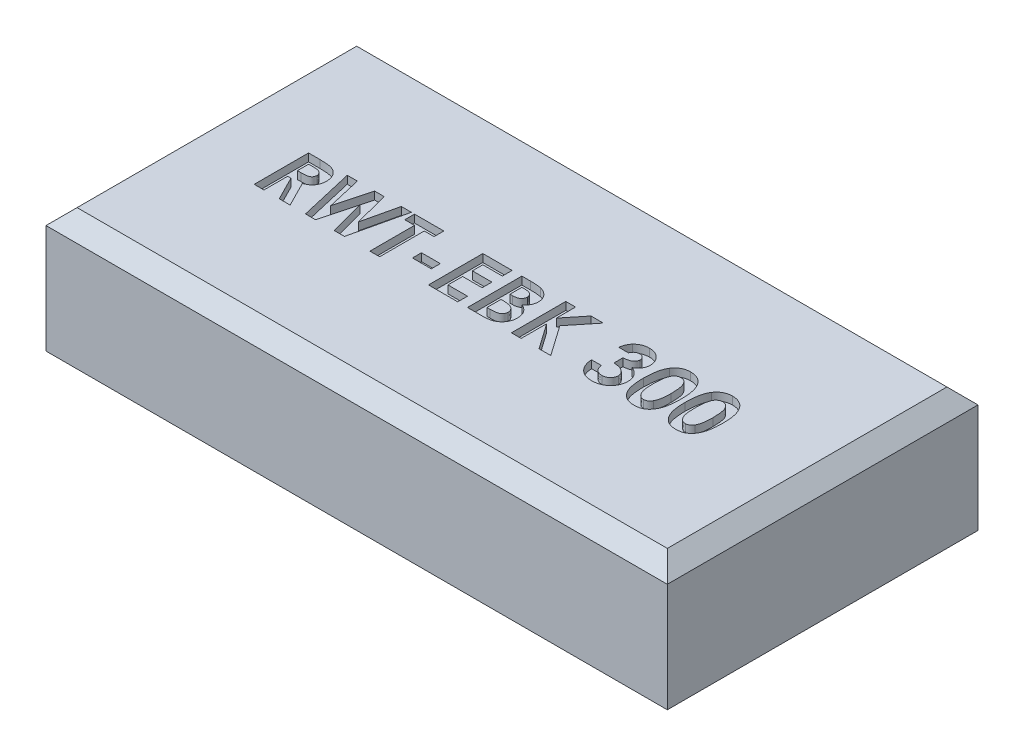
from build123d import *

# Parameters (mm, degrees)
SKETCH1_W           = 40
SKETCH1_H           = 20
BOSS_EXTRUDE1_DEPTH = 8
CHAMFER1_SIZE       = 1
SKETCH4_W           = 1.211538461
SKETCH4_H           = 0.583333333
CUT_EXTRUDE3_DEPTH  = 0.5


with BuildPart() as part:
    # Sketch1 → Boss-Extrude1 (new body)
    with BuildSketch(Plane(origin=(0, 0, 0), x_dir=(1, 0, 0), z_dir=(0, 1, 0))):
        with Locations((0, 2.318501171)):
            Rectangle(SKETCH1_W, SKETCH1_H)
    extrude(amount=BOSS_EXTRUDE1_DEPTH)

    # Chamfer1
    chamfer1_edges = [part.edges().sort_by_distance(p)[0] for p in [
        (0, 8, 7.681498829),
        (-20, 8, -2.318501171),
        (0, 8, -12.318501171),
        (20, 8, -2.318501171),
    ]]
    chamfer(chamfer1_edges, length=CHAMFER1_SIZE)

    # Sketch4 → Cut-Extrude3 (cut)
    # profile 1 of 10: a face of its own
    with BuildSketch(Plane(origin=(0, 8, 0), x_dir=(1, 0, 0), z_dir=(0, 1, 0))):
        with BuildLine():
            Line((-14.596153846, 3.818501171), (-13.864182692, 3.818501171))
            add(Edge.make_bspline(
                [(-13.864182692, 3.818501171), (-13.815799622, 3.818329439), (-13.722745349, 3.81799915), (-13.588566169, 3.81278806), (-13.46530414, 3.805536401), (-13.352776761, 3.794470177), (-13.251032173, 3.779797701), (-13.159968404, 3.76250128), (-13.079588115, 3.742788301), (-13.009213411, 3.718224373), (-12.945703721, 3.690516634), (-12.886503859, 3.658679935), (-12.830307791, 3.623068786), (-12.777491125, 3.582746162), (-12.727594872, 3.538437457), (-12.6805249, 3.49009807), (-12.636946351, 3.437318103), (-12.597129066, 3.380431058), (-12.560838815, 3.320587191), (-12.528765845, 3.257704336), (-12.502684052, 3.191738763), (-12.479637993, 3.123643816), (-12.463038663, 3.052446065), (-12.451494071, 2.978838632), (-12.443041573, 2.902562411), (-12.442555595, 2.850743733), (-12.442307692, 2.824310466)],
                knots=[0, 0, 0, 0, 1.749336639, 3.364467119, 4.854658419, 6.213483162, 7.451590619, 8.570285859, 9.5643256, 10.440900261, 11.26203566, 12.067320669, 12.869050712, 13.665104639, 14.467235401, 15.27997916, 16.102287765, 16.939272006, 17.78853747, 18.631303466, 19.488103222, 20.351255419, 21.228522269, 22.127379805, 23.044756219, 24, 24, 24, 24], degree=3))
            add(Edge.make_bspline(
                [(-12.442307692, 2.824310466), (-12.442951654, 2.796720207), (-12.444214347, 2.742620739), (-12.451015895, 2.663153032), (-12.46344699, 2.587123888), (-12.48227569, 2.514755912), (-12.503916836, 2.4451484), (-12.532694008, 2.379585653), (-12.565171892, 2.317114157), (-12.603744925, 2.258617595), (-12.646076944, 2.20279664), (-12.695308193, 2.151790002), (-12.748249241, 2.102856265), (-12.807876098, 2.059060474), (-12.871560358, 2.017441316), (-12.940567358, 1.979723274), (-13.014446736, 1.944958206), (-13.066387598, 1.925570802), (-13.092948718, 1.91565662)],
                knots=[0, 0, 0, 0, 1.099860209, 2.156625411, 3.176576793, 4.16617041, 5.135385252, 6.078461593, 7.016046972, 7.938469504, 8.868247731, 9.803980173, 10.76021508, 11.73834243, 12.748633912, 13.790971185, 14.870363756, 16, 16, 16, 16], degree=3))
            Line((-13.092948718, 1.91565662), (-12.28525641, 0.318501171))
            Line((-12.28525641, 0.318501171), (-12.983573718, 0.318501171))
            Line((-12.983573718, 0.318501171), (-13.754807692, 1.844142197))
            Line((-13.754807692, 1.844142197), (-13.967948718, 1.844142197))
            Line((-13.967948718, 1.844142197), (-13.967948718, 0.318501171))
            Line((-13.967948718, 0.318501171), (-14.596153846, 0.318501171))
            Line((-14.596153846, 0.318501171), (-14.596153846, 3.818501171))
        make_face()
        with BuildLine():
            Line((-13.967948718, 2.472347325), (-13.723257212, 2.472347325))
            add(Edge.make_bspline(
                [(-13.723257212, 2.472347325), (-13.693341641, 2.472684254), (-13.636059751, 2.473329401), (-13.55368087, 2.476321861), (-13.4788612, 2.483532211), (-13.41127944, 2.492642218), (-13.350595524, 2.503161037), (-13.297350732, 2.518235143), (-13.250724642, 2.534387429), (-13.211269776, 2.554460531), (-13.177560445, 2.577288002), (-13.148454596, 2.603220576), (-13.124379885, 2.633234229), (-13.104565169, 2.666513318), (-13.089151475, 2.70335219), (-13.07790066, 2.743346436), (-13.071613117, 2.786951643), (-13.070889714, 2.817045173), (-13.070512821, 2.832723927)],
                knots=[0, 0, 0, 0, 1.688639943, 3.233382647, 4.650958383, 5.928841754, 7.082724185, 8.122798841, 9.049171256, 9.863274652, 10.613301712, 11.341792392, 12.054588806, 12.776240173, 13.521029143, 14.301969904, 15.115324896, 16, 16, 16, 16], degree=3))
            add(Edge.make_bspline(
                [(-13.070512821, 2.832723927), (-13.071225372, 2.851273039), (-13.072625049, 2.88770933), (-13.086514186, 2.940164814), (-13.108622693, 2.988715953), (-13.1389274, 3.033143381), (-13.177092239, 3.072091531), (-13.220889403, 3.106424636), (-13.27126414, 3.133572687), (-13.317907356, 3.151479252), (-13.36034178, 3.162192934), (-13.398637509, 3.170176676), (-13.442984193, 3.175834983), (-13.493415313, 3.181836624), (-13.549802317, 3.185728385), (-13.612452548, 3.188568594), (-13.681186076, 3.189730664), (-13.729099873, 3.190102157), (-13.754106571, 3.190296043)],
                knots=[0, 0, 0, 0, 1.020303359, 2.004196876, 2.966617323, 3.9489082, 4.950758222, 5.960522915, 7.003732012, 8.091992268, 8.70421221, 9.413913587, 10.24622431, 11.166358409, 12.212345909, 13.359657661, 14.621978493, 16, 16, 16, 16], degree=3))
            Line((-13.754106571, 3.190296043), (-13.967948718, 3.190296043))
            Line((-13.967948718, 3.190296043), (-13.967948718, 2.472347325))
        make_face(mode=Mode.SUBTRACT)
    # profile 2 of 10: a face of its own
    with BuildSketch(Plane(origin=(0, 8, 0), x_dir=(1, 0, 0), z_dir=(0, 1, 0))):
        Polygon((-12.105769231, 3.818501171), (-11.457231571, 3.818501171), (-10.939102564, 1.584026011), (-10.345252404, 3.818501171), (-9.734575321, 3.818501171), (-9.144230769, 1.584026011), (-8.627504006, 3.818501171), (-7.977564103, 3.818501171), (-8.787359776, 0.318501171), (-9.443609776, 0.318501171), (-10.041666667, 2.581021203), (-10.643229167, 0.318501171), (-11.294571314, 0.318501171), align=None)
    # profile 3 of 10: a face of its own
    with BuildSketch(Plane(origin=(0, 8, 0), x_dir=(1, 0, 0), z_dir=(0, 1, 0))):
        Polygon((-7.775641026, 3.818501171), (-5.891025641, 3.818501171), (-5.891025641, 3.190296043), (-6.519230769, 3.190296043), (-6.519230769, 0.318501171), (-7.147435897, 0.318501171), (-7.147435897, 3.190296043), (-7.775641026, 3.190296043), align=None)
    # profile 4 of 10: a face of its own
    with BuildSketch(Plane(origin=(0, 8, 0), x_dir=(1, 0, 0), z_dir=(0, 1, 0))):
        with Locations((-4.791666667, 1.597347325)):
            Rectangle(SKETCH4_W, SKETCH4_H)
    # profile 5 of 10: a face of its own
    with BuildSketch(Plane(origin=(0, 8, 0), x_dir=(1, 0, 0), z_dir=(0, 1, 0))):
        Polygon((-3.378205128, 3.818501171), (-1.493589744, 3.818501171), (-1.493589744, 3.190296043), (-2.75, 3.190296043), (-2.75, 2.51721912), (-1.493589744, 2.51721912), (-1.493589744, 1.889013991), (-2.75, 1.889013991), (-2.75, 0.946706299), (-1.493589744, 0.946706299), (-1.493589744, 0.318501171), (-3.378205128, 0.318501171), align=None)
    # profile 6 of 10: a face of its own
    with BuildSketch(Plane(origin=(0, 8, 0), x_dir=(1, 0, 0), z_dir=(0, 1, 0))):
        with BuildLine():
            Line((-0.865384615, 0.318501171), (-0.865384615, 3.818501171))
            Line((-0.865384615, 3.818501171), (-0.304487179, 3.818501171))
            add(Edge.make_bspline(
                [(-0.304487179, 3.818501171), (-0.265220852, 3.818505652), (-0.189241252, 3.818514323), (-0.079622519, 3.814664873), (0.022039599, 3.809685178), (0.115421572, 3.804114058), (0.200682344, 3.794513904), (0.277692262, 3.784396391), (0.346605192, 3.772195293), (0.389210312, 3.76125053), (0.409254808, 3.756101331)],
                knots=[0, 0, 0, 0, 1.311965854, 2.538629056, 3.664479157, 4.713267157, 5.663616078, 6.530575999, 7.308677837, 8, 8, 8, 8], degree=3))
            add(Edge.make_bspline(
                [(0.409254808, 3.756101331), (0.435575266, 3.748838294), (0.487224455, 3.734585883), (0.561202576, 3.705802524), (0.631381143, 3.673807779), (0.697674471, 3.637307759), (0.759675491, 3.595861807), (0.817148578, 3.549140995), (0.871333285, 3.499020694), (0.920305637, 3.444104065), (0.964568575, 3.386074475), (1.003025131, 3.324947127), (1.03643895, 3.2616567), (1.063178757, 3.195406725), (1.083326699, 3.126502301), (1.09806282, 3.055237661), (1.107613822, 2.981387306), (1.108516267, 2.931144495), (1.108974359, 2.905640594)],
                knots=[0, 0, 0, 0, 1.099996261, 2.158545794, 3.195537121, 4.207578794, 5.205712374, 6.197378256, 7.190519799, 8.17788031, 9.159561366, 10.129234751, 11.085776129, 12.040971148, 13.00380137, 13.975669004, 14.972423361, 16, 16, 16, 16], degree=3))
            add(Edge.make_bspline(
                [(1.108974359, 2.905640594), (1.107776583, 2.872874775), (1.105418909, 2.808379286), (1.090357925, 2.713647082), (1.062116233, 2.624111532), (1.025162666, 2.538122532), (0.974917368, 2.456000819), (0.911115557, 2.377785442), (0.834790614, 2.30106803), (0.776245169, 2.255081117), (0.745793269, 2.231161427)],
                knots=[0, 0, 0, 0, 0.986156485, 1.941127874, 2.875419072, 3.804401753, 4.751181392, 5.761612777, 6.835722519, 8, 8, 8, 8], degree=3))
            add(Edge.make_bspline(
                [(0.745793269, 2.231161427), (0.770470028, 2.218564156), (0.818854324, 2.193864392), (0.887545811, 2.153265354), (0.951146629, 2.110083128), (1.009941945, 2.065186558), (1.062698461, 2.016672412), (1.111594582, 1.967336144), (1.154218027, 1.914350989), (1.192333195, 1.85960544), (1.225462281, 1.802306775), (1.254314061, 1.742551757), (1.278684124, 1.680136252), (1.299321324, 1.615377904), (1.314712554, 1.548053973), (1.324747963, 1.478140383), (1.332431699, 1.405875574), (1.333029422, 1.35665059), (1.333333333, 1.331622165)],
                knots=[0, 0, 0, 0, 1.164658916, 2.283573913, 3.35186032, 4.395461096, 5.390182219, 6.362969632, 7.312859996, 8.245001507, 9.165155236, 10.092416118, 11.032087915, 11.979892451, 12.947605196, 13.931445124, 14.948243989, 16, 16, 16, 16], degree=3))
            add(Edge.make_bspline(
                [(1.333333333, 1.331622165), (1.331361149, 1.283819302), (1.327469051, 1.189480545), (1.29901193, 1.050969584), (1.249676325, 0.91964863), (1.18342878, 0.796039608), (1.101799059, 0.683720797), (1.007948289, 0.585330494), (0.902821331, 0.502045287), (0.805829006, 0.445834233), (0.721938284, 0.40811136), (0.652453165, 0.384788701), (0.577827621, 0.363182624), (0.49669469, 0.348010391), (0.410525202, 0.334123096), (0.318478999, 0.325548791), (0.220728113, 0.319738197), (0.153588579, 0.318921849), (0.118990385, 0.318501171)],
                knots=[0, 0, 0, 0, 1.284142165, 2.534249414, 3.780121997, 5.041676246, 6.291546858, 7.49970053, 8.684500223, 9.883330709, 10.50184324, 11.153274765, 11.851151195, 12.587658647, 13.369265475, 14.195992086, 15.070362669, 16, 16, 16, 16], degree=3))
            Line((0.118990385, 0.318501171), (-0.865384615, 0.318501171))
        make_face()
        with BuildLine():
            Line((-0.237179487, 3.190296043), (-0.237179487, 2.42747553))
            Line((-0.237179487, 2.42747553), (-0.0703125, 2.42747553))
            add(Edge.make_bspline(
                [(-0.0703125, 2.42747553), (-0.047633777, 2.427673297), (-0.003853875, 2.428055074), (0.059381549, 2.432972233), (0.118180282, 2.441361212), (0.172319311, 2.453065948), (0.222302963, 2.467929257), (0.267811927, 2.485813017), (0.308646108, 2.507633149), (0.356085982, 2.540135198), (0.406233349, 2.587963419), (0.450377513, 2.657061193), (0.476378131, 2.736523371), (0.479273899, 2.792566252), (0.480769231, 2.821505979)],
                knots=[0, 0, 0, 0, 1.065314748, 2.056525647, 2.977365736, 3.853934255, 4.656397591, 5.425096493, 6.14721249, 6.826394842, 8.123232004, 9.372140726, 10.643011755, 12, 12, 12, 12], degree=3))
            add(Edge.make_bspline(
                [(0.480769231, 2.821505979), (0.479572691, 2.848612841), (0.47725923, 2.901022871), (0.451079951, 2.97461122), (0.410418355, 3.039825558), (0.362411626, 3.084459439), (0.317203962, 3.114943064), (0.278494386, 3.135015233), (0.236007719, 3.152983634), (0.188921466, 3.166722711), (0.137504514, 3.17703203), (0.082006625, 3.184602991), (0.022332045, 3.189756109), (-0.018885315, 3.190112204), (-0.040164263, 3.190296043)],
                knots=[0, 0, 0, 0, 1.347982417, 2.606269829, 3.849316587, 5.153353503, 5.842674298, 6.568177932, 7.326619318, 8.142485038, 9.012069166, 9.942760135, 10.937925643, 12, 12, 12, 12], degree=3))
            Line((-0.040164263, 3.190296043), (-0.237179487, 3.190296043))
        make_face(mode=Mode.SUBTRACT)
        with BuildLine():
            Line((-0.237179487, 1.844142197), (-0.237179487, 0.946706299))
            Line((-0.237179487, 0.946706299), (-0.056290064, 0.946706299))
            add(Edge.make_bspline(
                [(-0.056290064, 0.946706299), (-0.020527995, 0.946910607), (0.048229046, 0.947303413), (0.146723385, 0.952049449), (0.236279363, 0.960603342), (0.316659689, 0.971282188), (0.387987483, 0.985750355), (0.450021639, 1.004144774), (0.503612874, 1.02438184), (0.548439854, 1.049377018), (0.585060929, 1.078465208), (0.618107609, 1.108194036), (0.645051813, 1.142489048), (0.666370569, 1.179878054), (0.684821916, 1.219432285), (0.695950465, 1.262696318), (0.704423352, 1.308387911), (0.704889637, 1.339991798), (0.705128205, 1.356161427)],
                knots=[0, 0, 0, 0, 1.753078804, 3.370512758, 4.83203934, 6.162291463, 7.344201807, 8.395507345, 9.331626367, 10.147333109, 10.898971645, 11.62040215, 12.321813352, 13.025280112, 13.727906689, 14.453419512, 15.208716525, 16, 16, 16, 16], degree=3))
            add(Edge.make_bspline(
                [(0.705128205, 1.356161427), (0.704602095, 1.374651653), (0.703577374, 1.410665639), (0.695208464, 1.463303922), (0.67999942, 1.512445252), (0.660842888, 1.559346239), (0.634185556, 1.602327663), (0.602504228, 1.642876951), (0.564225095, 1.679620976), (0.521177978, 1.714782156), (0.470967777, 1.745567673), (0.413570936, 1.772279563), (0.348675643, 1.79458835), (0.27608088, 1.81235062), (0.196104895, 1.827425213), (0.108163951, 1.83642641), (0.012990452, 1.843120995), (-0.053004401, 1.843794061), (-0.087139423, 1.844142197)],
                knots=[0, 0, 0, 0, 0.845221588, 1.646264278, 2.427170338, 3.19324141, 3.95557735, 4.731569926, 5.540061037, 6.376114724, 7.268642756, 8.224665384, 9.265483498, 10.400594375, 11.639216012, 12.983232105, 14.439614077, 16, 16, 16, 16], degree=3))
            Line((-0.087139423, 1.844142197), (-0.237179487, 1.844142197))
        make_face(mode=Mode.SUBTRACT)
    # profile 7 of 10: a face of its own
    with BuildSketch(Plane(origin=(0, 8, 0), x_dir=(1, 0, 0), z_dir=(0, 1, 0))):
        Polygon((1.961538462, 3.818501171), (2.58974359, 3.818501171), (2.58974359, 2.586630177), (3.582532051, 3.818501171), (4.375500801, 3.818501171), (3.128205128, 2.270424248), (4.496794872, 0.318501171), (3.740284455, 0.318501171), (2.58974359, 1.959827293), (2.58974359, 0.318501171), (1.961538462, 0.318501171), align=None)
    # profile 8 of 10: a face of its own
    with BuildSketch(Plane(origin=(0, 8, 0), x_dir=(1, 0, 0), z_dir=(0, 1, 0))):
        with BuildLine():
            Line((6.852564103, 2.965937068), (6.224358974, 2.965937068))
            add(Edge.make_bspline(
                [(6.224358974, 2.965937068), (6.228794341, 2.997338802), (6.237489585, 3.05889982), (6.25829614, 3.148024838), (6.283183024, 3.232566017), (6.314253028, 3.312255633), (6.350693088, 3.387235639), (6.392132649, 3.45776333), (6.439019689, 3.523535987), (6.474959102, 3.563157697), (6.492888622, 3.582924248)],
                knots=[0, 0, 0, 0, 1.111473889, 2.178970933, 3.205615836, 4.199322666, 5.174200091, 6.12565194, 7.064921805, 8, 8, 8, 8], degree=3))
            add(Edge.make_bspline(
                [(6.492888622, 3.582924248), (6.518749579, 3.60900478), (6.569718807, 3.660406768), (6.654894365, 3.726247036), (6.74417408, 3.783227311), (6.839348495, 3.828401685), (6.938936626, 3.864965107), (7.04373043, 3.88952484), (7.153301684, 3.90582044), (7.22807028, 3.907425614), (7.266225962, 3.908244761)],
                knots=[0, 0, 0, 0, 1.01925491, 2.00884431, 2.983262333, 3.955970413, 4.92937149, 5.924503185, 6.940838805, 8, 8, 8, 8], degree=3))
            add(Edge.make_bspline(
                [(7.266225962, 3.908244761), (7.300148326, 3.90744392), (7.366832858, 3.905869629), (7.464842342, 3.893232074), (7.558286183, 3.87106721), (7.648152109, 3.842087147), (7.733118486, 3.802654929), (7.815060603, 3.756882516), (7.891688996, 3.70074075), (7.963182961, 3.637306204), (8.028863803, 3.568695533), (8.085743699, 3.495356368), (8.134644367, 3.419247767), (8.17493205, 3.339737412), (8.205907803, 3.256690761), (8.227405894, 3.170587565), (8.241476916, 3.081617815), (8.242878758, 3.021146275), (8.243589744, 2.990476331)],
                knots=[0, 0, 0, 0, 1.091422571, 2.145516843, 3.172569842, 4.178562979, 5.178154469, 6.181868002, 7.194278174, 8.227918432, 9.254613415, 10.245994977, 11.209837596, 12.161663635, 13.10878368, 14.055455738, 15.013766427, 16, 16, 16, 16], degree=3))
            add(Edge.make_bspline(
                [(8.243589744, 2.990476331), (8.242130758, 2.95249416), (8.239258465, 2.877718942), (8.21568922, 2.768279854), (8.178796942, 2.663636557), (8.125502458, 2.565253166), (8.058870779, 2.473397426), (7.97711594, 2.39114035), (7.882566532, 2.31719226), (7.811587032, 2.277452547), (7.775240385, 2.257102934)],
                knots=[0, 0, 0, 0, 0.992805628, 1.954529043, 2.915727527, 3.886831945, 4.871318353, 5.87440735, 6.911542536, 8, 8, 8, 8], degree=3))
            add(Edge.make_bspline(
                [(7.775240385, 2.257102934), (7.800188166, 2.248912052), (7.849209437, 2.232817336), (7.91888728, 2.201118976), (7.985142946, 2.166477923), (8.046835538, 2.126234151), (8.104578662, 2.082014939), (8.158020309, 2.033442287), (8.207479781, 1.980622105), (8.252149673, 1.923263901), (8.291795947, 1.86228501), (8.327368437, 1.799094007), (8.35664658, 1.732732589), (8.381448812, 1.663958648), (8.400331819, 1.592154081), (8.413627144, 1.517597124), (8.421312167, 1.440457846), (8.422484265, 1.388196032), (8.423076923, 1.361770402)],
                knots=[0, 0, 0, 0, 1.059543567, 2.081955587, 3.086750234, 4.076226789, 5.052108497, 6.020845489, 6.989030705, 7.970690546, 8.952259656, 9.923888338, 10.895517021, 11.877585046, 12.873342345, 13.889638361, 14.932918083, 16, 16, 16, 16], degree=3))
            add(Edge.make_bspline(
                [(8.423076923, 1.361770402), (8.421875525, 1.322935454), (8.419506612, 1.246360847), (8.404446172, 1.133574287), (8.376406347, 1.026042323), (8.339518404, 0.922527637), (8.290313891, 0.824366565), (8.232408452, 0.729306447), (8.161231032, 0.640643939), (8.082129552, 0.556035035), (7.994282747, 0.479112409), (7.899042519, 0.412423953), (7.798503119, 0.355193392), (7.692028462, 0.308731993), (7.579655542, 0.272951401), (7.461634826, 0.24708754), (7.337470424, 0.231263602), (7.252718505, 0.229604763), (7.209435096, 0.228757581)],
                knots=[0, 0, 0, 0, 1.005138573, 1.981928558, 2.936866704, 3.876260664, 4.820238198, 5.773547, 6.751179199, 7.756627054, 8.768222608, 9.766606018, 10.760583154, 11.757261445, 12.767156078, 13.807575856, 14.880313354, 16, 16, 16, 16], degree=3))
            add(Edge.make_bspline(
                [(7.209435096, 0.228757581), (7.168489689, 0.229650791), (7.088426364, 0.231397344), (6.971316994, 0.246514645), (6.860015623, 0.270900079), (6.754238208, 0.305273369), (6.654393993, 0.349849653), (6.559577553, 0.402930005), (6.471680928, 0.467575977), (6.389724778, 0.540869328), (6.315527135, 0.623100305), (6.249211916, 0.71236407), (6.192241383, 0.809000055), (6.144381897, 0.912595393), (6.106007614, 1.023331819), (6.075738092, 1.140984147), (6.054594335, 1.265782231), (6.048154959, 1.351645968), (6.044871795, 1.395424248)],
                knots=[0, 0, 0, 0, 1.066544725, 2.085487077, 3.070979577, 4.031932826, 4.977951092, 5.916076795, 6.857635327, 7.814973522, 8.776389752, 9.738577119, 10.707772778, 11.69409279, 12.707140348, 13.757286496, 14.856535458, 16, 16, 16, 16], degree=3))
            Line((6.044871795, 1.395424248), (6.673076923, 1.395424248))
            add(Edge.make_bspline(
                [(6.673076923, 1.395424248), (6.677057793, 1.373411954), (6.684811583, 1.33053724), (6.699934873, 1.268464184), (6.719642629, 1.21116692), (6.742429699, 1.158136191), (6.767043166, 1.108675722), (6.796782119, 1.064612209), (6.829467445, 1.024749149), (6.876632609, 0.977359505), (6.944058459, 0.928668623), (7.035105694, 0.88635393), (7.136387121, 0.861552321), (7.20719294, 0.858526601), (7.243790064, 0.856962709)],
                knots=[0, 0, 0, 0, 0.928156231, 1.807827665, 2.648129825, 3.438902246, 4.202261636, 4.936546065, 5.639352463, 6.338805438, 7.70633318, 9.064371875, 10.482673459, 12, 12, 12, 12], degree=3))
            add(Edge.make_bspline(
                [(7.243790064, 0.856962709), (7.263209792, 0.857295725), (7.301248694, 0.857948029), (7.357122177, 0.865177946), (7.410349537, 0.877085623), (7.461029913, 0.893267716), (7.509485937, 0.913552981), (7.554791811, 0.939709615), (7.597870981, 0.970120438), (7.638255136, 1.004310275), (7.675570928, 1.041564958), (7.706619862, 1.082818191), (7.73499634, 1.124738849), (7.755983788, 1.170069529), (7.774373314, 1.216370956), (7.785628643, 1.265323727), (7.794127225, 1.315900945), (7.794621129, 1.350513772), (7.794871795, 1.368080498)],
                knots=[0, 0, 0, 0, 1.110435564, 2.175094844, 3.216326037, 4.226890168, 5.215276772, 6.21526065, 7.213097102, 8.228249917, 9.239874822, 10.221364777, 11.178138315, 12.128914389, 13.072518965, 14.022636769, 14.996447288, 16, 16, 16, 16], degree=3))
            add(Edge.make_bspline(
                [(7.794871795, 1.368080498), (7.794206323, 1.387292705), (7.792881521, 1.425539807), (7.782057749, 1.481353411), (7.764964726, 1.535041599), (7.74122043, 1.586366615), (7.709512568, 1.635139286), (7.672097644, 1.682338139), (7.626027982, 1.725506557), (7.575483393, 1.76817723), (7.516871526, 1.805373188), (7.453046861, 1.839699592), (7.382331987, 1.867012812), (7.306453118, 1.891408576), (7.223974933, 1.909226863), (7.135409592, 1.922164677), (7.040899963, 1.931794874), (6.975753248, 1.933176484), (6.942307692, 1.933885786)],
                knots=[0, 0, 0, 0, 0.809814727, 1.612155564, 2.388397, 3.182215007, 3.988903953, 4.837162975, 5.715530372, 6.646997145, 7.623086902, 8.637258368, 9.698941581, 10.815059213, 11.996518529, 13.252603015, 14.589518788, 16, 16, 16, 16], degree=3))
            Line((6.942307692, 1.933885786), (6.942307692, 2.51721912))
            add(Edge.make_bspline(
                [(6.942307692, 2.51721912), (6.983949398, 2.520765461), (7.061852782, 2.527399962), (7.169986857, 2.542914974), (7.261021809, 2.563653343), (7.337145665, 2.588673062), (7.400354037, 2.6208049), (7.455572522, 2.656277029), (7.503129293, 2.697472724), (7.543321144, 2.743163534), (7.575473375, 2.792231179), (7.59822885, 2.843913002), (7.613255377, 2.896609906), (7.61467914, 2.932652999), (7.615384615, 2.950512389)],
                knots=[0, 0, 0, 0, 1.70044513, 3.18119609, 4.440695891, 5.496282586, 6.431922213, 7.318171381, 8.16090191, 8.983045123, 9.787564368, 10.536848927, 11.275007137, 12, 12, 12, 12], degree=3))
            add(Edge.make_bspline(
                [(7.615384615, 2.950512389), (7.614167468, 2.973299031), (7.611791854, 3.017773733), (7.593341546, 3.0814264), (7.561313904, 3.138167477), (7.518370458, 3.187877565), (7.466042377, 3.229399156), (7.404704693, 3.259543123), (7.335688437, 3.277254049), (7.287131782, 3.279090076), (7.262019231, 3.280039632)],
                knots=[0, 0, 0, 0, 1.009664648, 1.970651636, 2.907870547, 3.878035693, 4.867062054, 5.849714035, 6.887914197, 8, 8, 8, 8], degree=3))
            add(Edge.make_bspline(
                [(7.262019231, 3.280039632), (7.239257527, 3.278919255), (7.194091334, 3.276696084), (7.128044841, 3.26010292), (7.065322678, 3.232170393), (7.007223642, 3.193653085), (6.954586406, 3.147395431), (6.911386421, 3.092612841), (6.875454723, 3.032587436), (6.860224222, 2.988240953), (6.852564103, 2.965937068)],
                knots=[0, 0, 0, 0, 0.98818071, 1.960853194, 2.938124878, 3.957524365, 4.978590984, 5.968022688, 6.978025184, 8, 8, 8, 8], degree=3))
        make_face()
    # profile 9 of 10: a face of its own
    with BuildSketch(Plane(origin=(0, 8, 0), x_dir=(1, 0, 0), z_dir=(0, 1, 0))):
        with BuildLine():
            add(Edge.make_bspline(
                [(9.915765224, 3.908244761), (9.94617296, 3.907793349), (10.005962692, 3.906905754), (10.094021714, 3.897292372), (10.178846898, 3.882769234), (10.260770092, 3.86251452), (10.339201605, 3.835708128), (10.414712276, 3.803621336), (10.48640331, 3.764571127), (10.555188998, 3.720461909), (10.621042843, 3.670524021), (10.682382094, 3.613592251), (10.740326935, 3.550976601), (10.793623075, 3.481730434), (10.843450772, 3.406483618), (10.889646302, 3.325224221), (10.931856026, 3.237554532), (10.970553014, 3.143316345), (11.005155982, 3.04109707), (11.03430202, 2.929724208), (11.059299625, 2.809172324), (11.080399367, 2.679141347), (11.096347361, 2.539458435), (11.107096631, 2.390216385), (11.114473288, 2.231702915), (11.115075319, 2.122963977), (11.115384615, 2.067098927)],
                knots=[0, 0, 0, 0, 0.879237366, 1.728815576, 2.559023295, 3.367336655, 4.166867292, 4.954216142, 5.737608147, 6.525189134, 7.316157332, 8.124696809, 8.942788509, 9.781158001, 10.649253743, 11.551476218, 12.482711956, 13.461909668, 14.496590415, 15.601789533, 16.789733467, 18.056700938, 19.410929216, 20.8549011, 22.384193279, 24, 24, 24, 24], degree=3))
            add(Edge.make_bspline(
                [(11.115384615, 2.067098927), (11.11505035, 2.010534943), (11.114400879, 1.900632136), (11.10740328, 1.740668821), (11.095353086, 1.590343185), (11.079821925, 1.449670779), (11.058548484, 1.31872589), (11.033634327, 1.19716946), (11.004028228, 1.085045549), (10.968285448, 0.982606796), (10.929822694, 0.888203106), (10.887497509, 0.800704352), (10.842047614, 0.71987354), (10.794515494, 0.644491226), (10.742295263, 0.576779642), (10.687928626, 0.514436242), (10.629048363, 0.459835764), (10.568133562, 0.410164346), (10.502952665, 0.367238273), (10.434177868, 0.329695837), (10.360583034, 0.299244462), (10.283509672, 0.272759483), (10.201644051, 0.253746125), (10.116287005, 0.238659651), (10.026474869, 0.23032194), (9.96532715, 0.229287592), (9.933994391, 0.228757581)],
                knots=[0, 0, 0, 0, 1.643780988, 3.193836972, 4.651895693, 6.025988579, 7.305620092, 8.505800249, 9.631074763, 10.672816429, 11.65661981, 12.592235626, 13.49536222, 14.350718032, 15.179365177, 15.97804903, 16.751647189, 17.51006938, 18.259804725, 19.016521909, 19.783502495, 20.571750527, 21.382245291, 22.22305063, 23.089471752, 24, 24, 24, 24], degree=3))
            add(Edge.make_bspline(
                [(9.933994391, 0.228757581), (9.902662478, 0.229297816), (9.841283721, 0.230356128), (9.751228725, 0.238597657), (9.665419329, 0.253807241), (9.58290602, 0.272905453), (9.504263076, 0.299185861), (9.429113408, 0.330548319), (9.358034851, 0.367856509), (9.2908306, 0.410882596), (9.227730109, 0.460221675), (9.167752798, 0.515346009), (9.111031339, 0.576115872), (9.058428606, 0.643211936), (9.00908312, 0.71573861), (8.963509474, 0.794524112), (8.921735059, 0.879453732), (8.882453162, 0.970645855), (8.848322166, 1.070063741), (8.817947164, 1.17859518), (8.793064761, 1.297144871), (8.773052668, 1.425674728), (8.757075024, 1.563912456), (8.745189494, 1.711924777), (8.738153027, 1.869780633), (8.737510367, 1.978282826), (8.737179487, 2.034146203)],
                knots=[0, 0, 0, 0, 0.917216111, 1.796812873, 2.643793957, 3.46689424, 4.273913431, 5.068098542, 5.848489301, 6.620921603, 7.401012384, 8.190319798, 9.003608147, 9.831726257, 10.68377682, 11.569763213, 12.493818149, 13.453288342, 14.474581811, 15.568529029, 16.750744269, 18.018426408, 19.375425659, 20.823733699, 22.36466933, 24, 24, 24, 24], degree=3))
            add(Edge.make_bspline(
                [(8.737179487, 2.034146203), (8.737778845, 2.111763968), (8.738935314, 2.261528446), (8.753590934, 2.477894573), (8.775101668, 2.677887577), (8.80669584, 2.861172919), (8.845761597, 3.028429436), (8.895787333, 3.178555327), (8.952737994, 3.313627923), (9.001267274, 3.393645742), (9.024639423, 3.432183062)],
                knots=[0, 0, 0, 0, 1.288568992, 2.486310467, 3.599230591, 4.627010532, 5.572937695, 6.447898582, 7.252493626, 8, 8, 8, 8], degree=3))
            add(Edge.make_bspline(
                [(9.024639423, 3.432183062), (9.051815445, 3.470042113), (9.104949923, 3.544064019), (9.197857043, 3.641240945), (9.297673647, 3.72435141), (9.406449911, 3.791514551), (9.522465493, 3.844479409), (9.646716447, 3.881887892), (9.778743933, 3.903683818), (9.869409411, 3.906701743), (9.915765224, 3.908244761)],
                knots=[0, 0, 0, 0, 1.058512271, 2.069600068, 3.047294572, 4.004278952, 4.967380941, 5.939006123, 6.946246673, 8, 8, 8, 8], degree=3))
        make_face()
        with BuildLine():
            add(Edge.make_bspline(
                [(9.931189904, 3.280039632), (9.903701059, 3.278736716), (9.84980833, 3.276182308), (9.771607414, 3.254498986), (9.697868832, 3.221007927), (9.641777862, 3.180706674), (9.599794329, 3.142073089), (9.570460134, 3.107110952), (9.542171926, 3.068095726), (9.517186356, 3.023266856), (9.493593455, 2.974235095), (9.47053608, 2.920777869), (9.451635087, 2.861582152), (9.433065363, 2.797656056), (9.416796552, 2.727232193), (9.403166854, 2.649734927), (9.390989918, 2.564660285), (9.382496359, 2.471952543), (9.374577814, 2.371708697), (9.368901426, 2.263705442), (9.36652827, 2.147971914), (9.365773916, 2.068267952), (9.365384615, 2.027134985)],
                knots=[0, 0, 0, 0, 1.076674018, 2.110852608, 3.161083442, 4.239746716, 4.804137807, 5.395870207, 6.026861976, 6.692161227, 7.405688833, 8.16177676, 8.973626916, 9.841385931, 10.773283133, 11.807421078, 12.927755683, 14.143907515, 15.458935494, 16.872852025, 18.386167141, 20, 20, 20, 20], degree=3))
            add(Edge.make_bspline(
                [(9.365384615, 2.027134985), (9.366025357, 1.973845238), (9.367254027, 1.871658197), (9.373689226, 1.724709674), (9.386588049, 1.590974686), (9.40263158, 1.46954686), (9.425165374, 1.361213689), (9.451091964, 1.264950241), (9.483108996, 1.181983641), (9.520110846, 1.111114005), (9.561092062, 1.050825352), (9.605578975, 0.999579726), (9.652056964, 0.955203432), (9.70197676, 0.919157115), (9.755219267, 0.891532879), (9.81134001, 0.871663107), (9.870374652, 0.859499993), (9.910800967, 0.85781336), (9.931189904, 0.856962709)],
                knots=[0, 0, 0, 0, 1.771748488, 3.397459088, 4.888034009, 6.237357457, 7.467047327, 8.564189669, 9.548206622, 10.417051504, 11.216568818, 11.965764335, 12.669334354, 13.348544111, 14.005342236, 14.656555988, 15.322436492, 16, 16, 16, 16], degree=3))
            add(Edge.make_bspline(
                [(9.931189904, 0.856962709), (9.950879157, 0.857544788), (9.989428267, 0.858684424), (10.045641503, 0.87038264), (10.098800732, 0.889401398), (10.148745452, 0.916304766), (10.195654308, 0.950516515), (10.239298036, 0.992186986), (10.279347487, 1.041731537), (10.302680478, 1.07850092), (10.314703526, 1.097447485)],
                knots=[0, 0, 0, 0, 0.992283464, 1.942767638, 2.88273346, 3.832339453, 4.79467288, 5.803907806, 6.868395428, 8, 8, 8, 8], degree=3))
            add(Edge.make_bspline(
                [(10.314703526, 1.097447485), (10.328858639, 1.12333736), (10.358540763, 1.177626329), (10.392888969, 1.269236938), (10.421801373, 1.372558565), (10.446685858, 1.487912756), (10.463705327, 1.615754481), (10.478362473, 1.755273086), (10.485431979, 1.907171129), (10.486581872, 2.012406641), (10.487179487, 2.067098927)],
                knots=[0, 0, 0, 0, 0.710965849, 1.490837728, 2.352621235, 3.297892224, 4.334225155, 5.461620853, 6.680770821, 8, 8, 8, 8], degree=3))
            add(Edge.make_bspline(
                [(10.487179487, 2.067098927), (10.486948641, 2.122265969), (10.486504303, 2.228453106), (10.478351976, 2.380897234), (10.466999238, 2.520129644), (10.450393459, 2.645839487), (10.429027107, 2.758331932), (10.402692997, 2.857599625), (10.37164704, 2.943838204), (10.334830235, 3.016961676), (10.294053336, 3.079106596), (10.250767413, 3.132422118), (10.204789436, 3.177941565), (10.156196294, 3.215836235), (10.103863282, 3.244790606), (10.04879003, 3.265234787), (9.990863632, 3.27760283), (9.951349628, 3.279216402), (9.931189904, 3.280039632)],
                knots=[0, 0, 0, 0, 1.793836731, 3.452829483, 4.963243077, 6.335886805, 7.574563692, 8.684454726, 9.672768357, 10.54971625, 11.340229787, 12.085688095, 12.778991901, 13.440269426, 14.083255152, 14.715733572, 15.344777694, 16, 16, 16, 16], degree=3))
        make_face(mode=Mode.SUBTRACT)
    # profile 10 of 10: a face of its own
    with BuildSketch(Plane(origin=(0, 8, 0), x_dir=(1, 0, 0), z_dir=(0, 1, 0))):
        with BuildLine():
            add(Edge.make_bspline(
                [(12.608072917, 3.908244761), (12.638480652, 3.907793349), (12.698270385, 3.906905754), (12.786329406, 3.897292372), (12.871154591, 3.882769234), (12.953077785, 3.86251452), (13.031509297, 3.835708128), (13.107019968, 3.803621336), (13.178711003, 3.764571127), (13.247496691, 3.720461909), (13.313350535, 3.670524021), (13.374689786, 3.613592251), (13.432634627, 3.550976601), (13.485930767, 3.481730434), (13.535758465, 3.406483618), (13.581953994, 3.325224221), (13.624163718, 3.237554532), (13.662860706, 3.143316345), (13.697463675, 3.04109707), (13.726609713, 2.929724208), (13.751607317, 2.809172324), (13.772707059, 2.679141347), (13.788655053, 2.539458435), (13.799404323, 2.390216385), (13.80678098, 2.231702915), (13.807383012, 2.122963977), (13.807692308, 2.067098927)],
                knots=[0, 0, 0, 0, 0.879237366, 1.728815576, 2.559023295, 3.367336655, 4.166867292, 4.954216142, 5.737608147, 6.525189134, 7.316157332, 8.124696809, 8.942788509, 9.781158001, 10.649253743, 11.551476218, 12.482711956, 13.461909668, 14.496590415, 15.601789533, 16.789733467, 18.056700938, 19.410929216, 20.8549011, 22.384193279, 24, 24, 24, 24], degree=3))
            add(Edge.make_bspline(
                [(13.807692308, 2.067098927), (13.807358042, 2.010534943), (13.806708571, 1.900632136), (13.799710973, 1.740668821), (13.787660778, 1.590343185), (13.772129618, 1.449670779), (13.750856176, 1.31872589), (13.725942019, 1.19716946), (13.69633592, 1.085045549), (13.660593141, 0.982606796), (13.622130387, 0.888203106), (13.579805201, 0.800704352), (13.534355307, 0.71987354), (13.486823186, 0.644491226), (13.434602955, 0.576779642), (13.380236318, 0.514436242), (13.321356056, 0.459835764), (13.260441254, 0.410164346), (13.195260358, 0.367238273), (13.12648556, 0.329695837), (13.052890726, 0.299244462), (12.975817364, 0.272759483), (12.893951743, 0.253746125), (12.808594697, 0.238659651), (12.718782561, 0.23032194), (12.657634842, 0.229287592), (12.626302083, 0.228757581)],
                knots=[0, 0, 0, 0, 1.643780988, 3.193836972, 4.651895693, 6.025988579, 7.305620092, 8.505800249, 9.631074763, 10.672816429, 11.65661981, 12.592235626, 13.49536222, 14.350718032, 15.179365177, 15.97804903, 16.751647189, 17.51006938, 18.259804725, 19.016521909, 19.783502495, 20.571750527, 21.382245291, 22.22305063, 23.089471752, 24, 24, 24, 24], degree=3))
            add(Edge.make_bspline(
                [(12.626302083, 0.228757581), (12.59497017, 0.229297816), (12.533591414, 0.230356128), (12.443536417, 0.238597657), (12.357727022, 0.253807241), (12.275213712, 0.272905453), (12.196570768, 0.299185861), (12.1214211, 0.330548319), (12.050342543, 0.367856509), (11.983138292, 0.410882596), (11.920037802, 0.460221675), (11.86006049, 0.515346009), (11.803339031, 0.576115872), (11.750736299, 0.643211936), (11.701390812, 0.71573861), (11.655817167, 0.794524112), (11.614042751, 0.879453732), (11.574760854, 0.970645855), (11.540629858, 1.070063741), (11.510254856, 1.17859518), (11.485372454, 1.297144871), (11.46536036, 1.425674728), (11.449382717, 1.563912456), (11.437497186, 1.711924777), (11.43046072, 1.869780633), (11.429818059, 1.978282826), (11.429487179, 2.034146203)],
                knots=[0, 0, 0, 0, 0.917216111, 1.796812873, 2.643793957, 3.46689424, 4.273913431, 5.068098542, 5.848489301, 6.620921603, 7.401012384, 8.190319798, 9.003608147, 9.831726257, 10.68377682, 11.569763213, 12.493818149, 13.453288342, 14.474581811, 15.568529029, 16.750744269, 18.018426408, 19.375425659, 20.823733699, 22.36466933, 24, 24, 24, 24], degree=3))
            add(Edge.make_bspline(
                [(11.429487179, 2.034146203), (11.430086537, 2.111763968), (11.431243006, 2.261528446), (11.445898626, 2.477894573), (11.46740936, 2.677887577), (11.499003532, 2.861172919), (11.538069289, 3.028429436), (11.588095025, 3.178555327), (11.645045686, 3.313627923), (11.693574966, 3.393645742), (11.716947115, 3.432183062)],
                knots=[0, 0, 0, 0, 1.288568992, 2.486310467, 3.599230591, 4.627010532, 5.572937695, 6.447898582, 7.252493626, 8, 8, 8, 8], degree=3))
            add(Edge.make_bspline(
                [(11.716947115, 3.432183062), (11.744123137, 3.470042113), (11.797257615, 3.544064019), (11.890164735, 3.641240945), (11.989981339, 3.72435141), (12.098757603, 3.791514551), (12.214773185, 3.844479409), (12.339024139, 3.881887892), (12.471051626, 3.903683818), (12.561717103, 3.906701743), (12.608072917, 3.908244761)],
                knots=[0, 0, 0, 0, 1.058512271, 2.069600068, 3.047294572, 4.004278952, 4.967380941, 5.939006123, 6.946246673, 8, 8, 8, 8], degree=3))
        make_face()
        with BuildLine():
            add(Edge.make_bspline(
                [(12.623497596, 3.280039632), (12.596008751, 3.278736716), (12.542116023, 3.276182308), (12.463915106, 3.254498986), (12.390176524, 3.221007927), (12.334085555, 3.180706674), (12.292102022, 3.142073089), (12.262767826, 3.107110952), (12.234479618, 3.068095726), (12.209494048, 3.023266856), (12.185901148, 2.974235095), (12.162843773, 2.920777869), (12.14394278, 2.861582152), (12.125373055, 2.797656056), (12.109104244, 2.727232193), (12.095474546, 2.649734927), (12.08329761, 2.564660285), (12.074804052, 2.471952543), (12.066885506, 2.371708697), (12.061209118, 2.263705442), (12.058835962, 2.147971914), (12.058081608, 2.068267952), (12.057692308, 2.027134985)],
                knots=[0, 0, 0, 0, 1.076674018, 2.110852608, 3.161083442, 4.239746716, 4.804137807, 5.395870207, 6.026861976, 6.692161227, 7.405688833, 8.16177676, 8.973626916, 9.841385931, 10.773283133, 11.807421078, 12.927755683, 14.143907515, 15.458935494, 16.872852025, 18.386167141, 20, 20, 20, 20], degree=3))
            add(Edge.make_bspline(
                [(12.057692308, 2.027134985), (12.05833305, 1.973845238), (12.05956172, 1.871658197), (12.065996919, 1.724709674), (12.078895741, 1.590974686), (12.094939272, 1.46954686), (12.117473067, 1.361213689), (12.143399656, 1.264950241), (12.175416688, 1.181983641), (12.212418538, 1.111114005), (12.253399754, 1.050825352), (12.297886667, 0.999579726), (12.344364656, 0.955203432), (12.394284452, 0.919157115), (12.44752696, 0.891532879), (12.503647703, 0.871663107), (12.562682345, 0.859499993), (12.603108659, 0.85781336), (12.623497596, 0.856962709)],
                knots=[0, 0, 0, 0, 1.771748488, 3.397459088, 4.888034009, 6.237357457, 7.467047327, 8.564189669, 9.548206622, 10.417051504, 11.216568818, 11.965764335, 12.669334354, 13.348544111, 14.005342236, 14.656555988, 15.322436492, 16, 16, 16, 16], degree=3))
            add(Edge.make_bspline(
                [(12.623497596, 0.856962709), (12.64318685, 0.857544788), (12.681735959, 0.858684424), (12.737949195, 0.87038264), (12.791108425, 0.889401398), (12.841053145, 0.916304766), (12.887962, 0.950516515), (12.931605729, 0.992186986), (12.971655179, 1.041731537), (12.994988171, 1.07850092), (13.007011218, 1.097447485)],
                knots=[0, 0, 0, 0, 0.992283464, 1.942767638, 2.88273346, 3.832339453, 4.79467288, 5.803907806, 6.868395428, 8, 8, 8, 8], degree=3))
            add(Edge.make_bspline(
                [(13.007011218, 1.097447485), (13.021166331, 1.12333736), (13.050848455, 1.177626329), (13.085196661, 1.269236938), (13.114109066, 1.372558565), (13.13899355, 1.487912756), (13.156013019, 1.615754481), (13.170670165, 1.755273086), (13.177739671, 1.907171129), (13.178889565, 2.012406641), (13.179487179, 2.067098927)],
                knots=[0, 0, 0, 0, 0.710965849, 1.490837728, 2.352621235, 3.297892224, 4.334225155, 5.461620853, 6.680770821, 8, 8, 8, 8], degree=3))
            add(Edge.make_bspline(
                [(13.179487179, 2.067098927), (13.179256334, 2.122265969), (13.178811995, 2.228453106), (13.170659668, 2.380897234), (13.15930693, 2.520129644), (13.142701151, 2.645839487), (13.121334799, 2.758331932), (13.095000689, 2.857599625), (13.063954732, 2.943838204), (13.027137927, 3.016961676), (12.986361029, 3.079106596), (12.943075106, 3.132422118), (12.897097128, 3.177941565), (12.848503986, 3.215836235), (12.796170975, 3.244790606), (12.741097722, 3.265234787), (12.683171324, 3.27760283), (12.64365732, 3.279216402), (12.623497596, 3.280039632)],
                knots=[0, 0, 0, 0, 1.793836731, 3.452829483, 4.963243077, 6.335886805, 7.574563692, 8.684454726, 9.672768357, 10.54971625, 11.340229787, 12.085688095, 12.778991901, 13.440269426, 14.083255152, 14.715733572, 15.344777694, 16, 16, 16, 16], degree=3))
        make_face(mode=Mode.SUBTRACT)
    extrude(amount=-CUT_EXTRUDE3_DEPTH, mode=Mode.SUBTRACT)


solid = part.part
